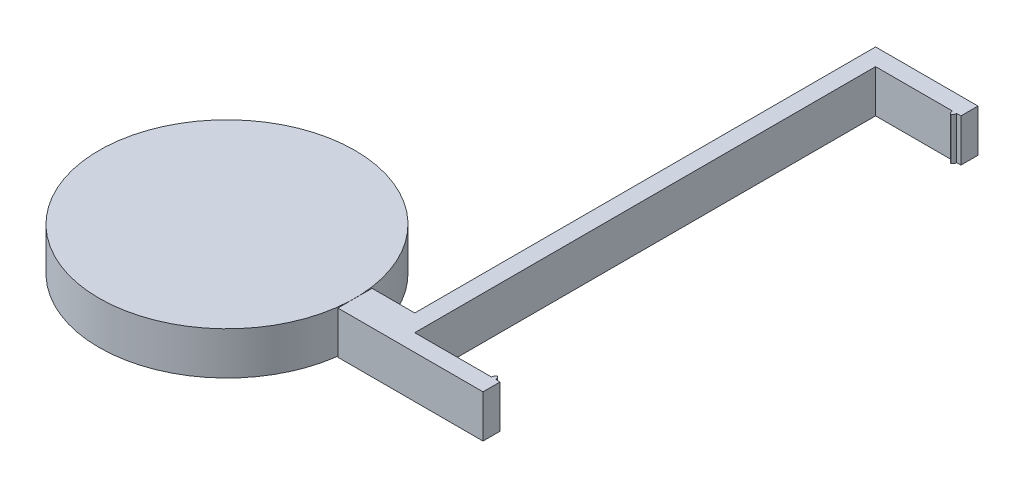
from build123d import *

# Parameters (mm, degrees)
SKETCH6_W                = 58
SKETCH6_H                = 5
BOSS_EXTRUDE2_DEPTH      = 12
SKETCH7_W                = 54
SKETCH7_H                = 5
CUT_EXTRUDE3_DEPTH       = 10
SKETCH8_W                = 0.5
SKETCH8_H                = 5
BOSS_EXTRUDE3_DEPTH      = 0.5
FILLET1_R                = 0.5
FILLET1_OF_MIRROR3_R     = 0.5
SKETCH9_W                = 4
SKETCH9_H                = 5
BOSS_EXTRUDE4_DEPTH      = 5
BOSS_EXTRUDE5_DEPTH      = 2.5
BOSS_EXTRUDE5_DEPTH_BACK = 2.5
SKETCH11_R               = 15


with BuildPart() as part:
    # Sketch6 → Boss-Extrude2 (new body)
    with BuildSketch(Plane(origin=(0, 0, 0), x_dir=(0, 0, -1), z_dir=(1, 0, 0))):
        Rectangle(SKETCH6_W, SKETCH6_H)
    extrude(amount=BOSS_EXTRUDE2_DEPTH)

    # Sketch7 → Cut-Extrude3 (cut)
    with BuildSketch(Plane(origin=(12, 0, 0), x_dir=(0, 0, -1), z_dir=(1, 0, 0))):
        Rectangle(SKETCH7_W, SKETCH7_H)
    extrude(amount=-CUT_EXTRUDE3_DEPTH, mode=Mode.SUBTRACT)

    # Sketch8 → Boss-Extrude3 (add)
    with BuildSketch(Plane.XY.offset(-27)):
        with Locations((11.25, 0)):
            Rectangle(SKETCH8_W, SKETCH8_H)
    boss_extrude3 = extrude(amount=BOSS_EXTRUDE3_DEPTH)

    # Fillet1
    # the kernel refuses this fillet: 0.5 mm, written as the material it takes off along each edge
    with BuildSketch(Plane(origin=(11, -3.75, -26.5), x_dir=(0, 0, -1), z_dir=(0, 1, 0)), Plane(origin=(11.5, 3.75, -26.5), x_dir=(0, 0, -1), z_dir=(0, -1, 0))) as fillet1_piece_1:
        with BuildLine():
            CenterArc((FILLET1_R, -FILLET1_R), FILLET1_R, 90, 90)
            Line((0, -FILLET1_R), (0, 0))
            Line((0, 0), (FILLET1_R, 0))
        make_face()
    extrude(amount=7.5, mode=Mode.SUBTRACT)

    # Mirror3: Boss-Extrude3 across plane
    add(boss_extrude3.mirror(Plane(origin=(0, 0, 0), x_dir=(1, 0, 0), z_dir=(0, 0, -1))))

    # Fillet1 of Mirror3
    # the kernel refuses this fillet: 0.5 mm, written as the material it takes off along each edge
    with BuildSketch(Plane(origin=(11, -3.75, 26.5), x_dir=(0, 0, 1), z_dir=(0, 1, 0)), Plane(origin=(11.5, 3.75, 26.5), x_dir=(0, 0, 1), z_dir=(0, -1, 0))) as fillet1_of_mirror3_piece_1:
        with BuildLine():
            CenterArc((FILLET1_OF_MIRROR3_R, FILLET1_OF_MIRROR3_R), FILLET1_OF_MIRROR3_R, 180, 90)
            Line((0, FILLET1_OF_MIRROR3_R), (0, 0))
            Line((0, 0), (FILLET1_OF_MIRROR3_R, 0))
        make_face()
    extrude(amount=7.5, mode=Mode.SUBTRACT)

    # Sketch9 → Boss-Extrude4 (add)
    with BuildSketch(Plane.ZY):
        with Locations((27, 0)):
            Rectangle(SKETCH9_W, SKETCH9_H)
    extrude(amount=BOSS_EXTRUDE4_DEPTH)


with BuildPart() as body_2:
    # Sketch11 → Boss-Extrude5 (new, two sides: drawn at the far end of the back side and taken through both)
    with BuildSketch(Plane(origin=(0, 0, 0), x_dir=(1, 0, 0), z_dir=(0, 1, 0)).offset(-BOSS_EXTRUDE5_DEPTH_BACK)):
        with Locations(Location((-20, -27, 0), (0, 0, 270))):
            Circle(SKETCH11_R)
    extrude(amount=BOSS_EXTRUDE5_DEPTH + BOSS_EXTRUDE5_DEPTH_BACK)


solid = Compound([part.part, body_2.part])
